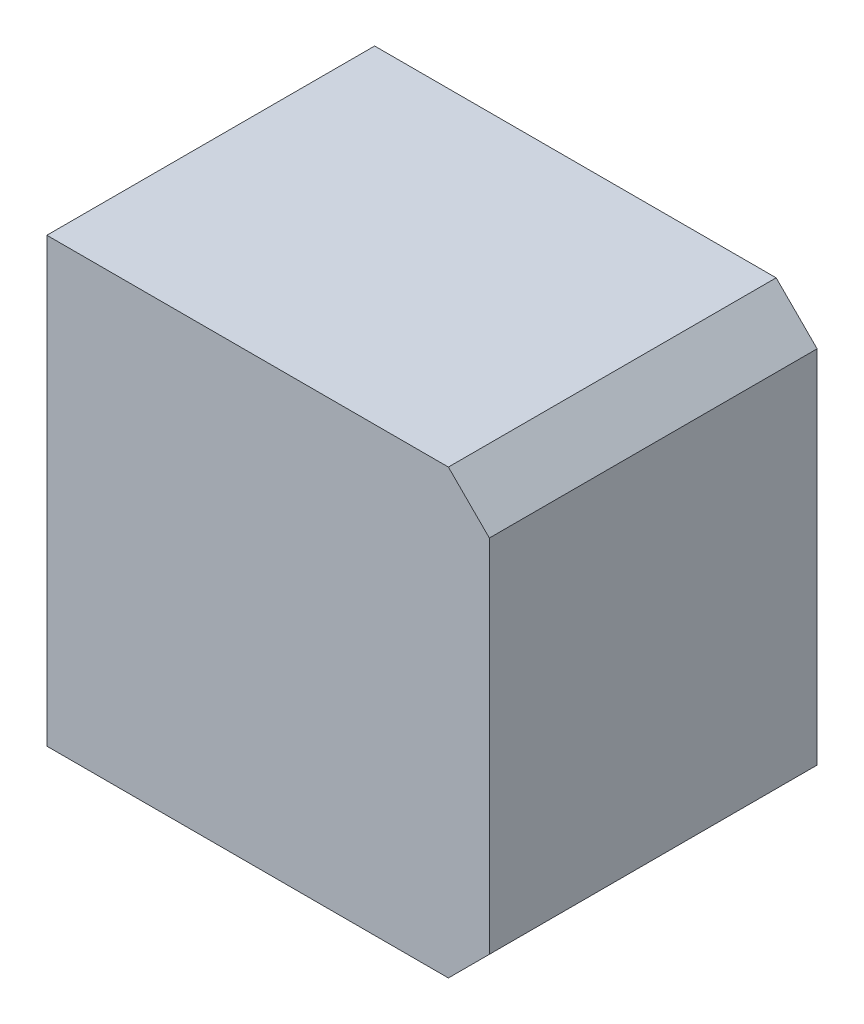
from build123d import *

# Parameters (mm, degrees)
SKETCH_1_W      = 10.8
SKETCH_1_H      = 10.8
EXTRUDE_1_DEPTH = 4
CHAMFER_1_SIZE  = 1


with BuildPart() as part:
    # 草图1 → 凸台-拉伸1 (new, symmetric)
    with BuildSketch(Plane.XY):
        Rectangle(SKETCH_1_W, SKETCH_1_H)
    extrude(amount=EXTRUDE_1_DEPTH, both=True)

    # 倒角1
    chamfer_1_edges = [part.edges().sort_by_distance(p)[0] for p in [
        (5.4, 5.4, 0),
        (5.4, -5.4, 0),
    ]]
    chamfer(chamfer_1_edges, length=CHAMFER_1_SIZE)


solid = part.part
